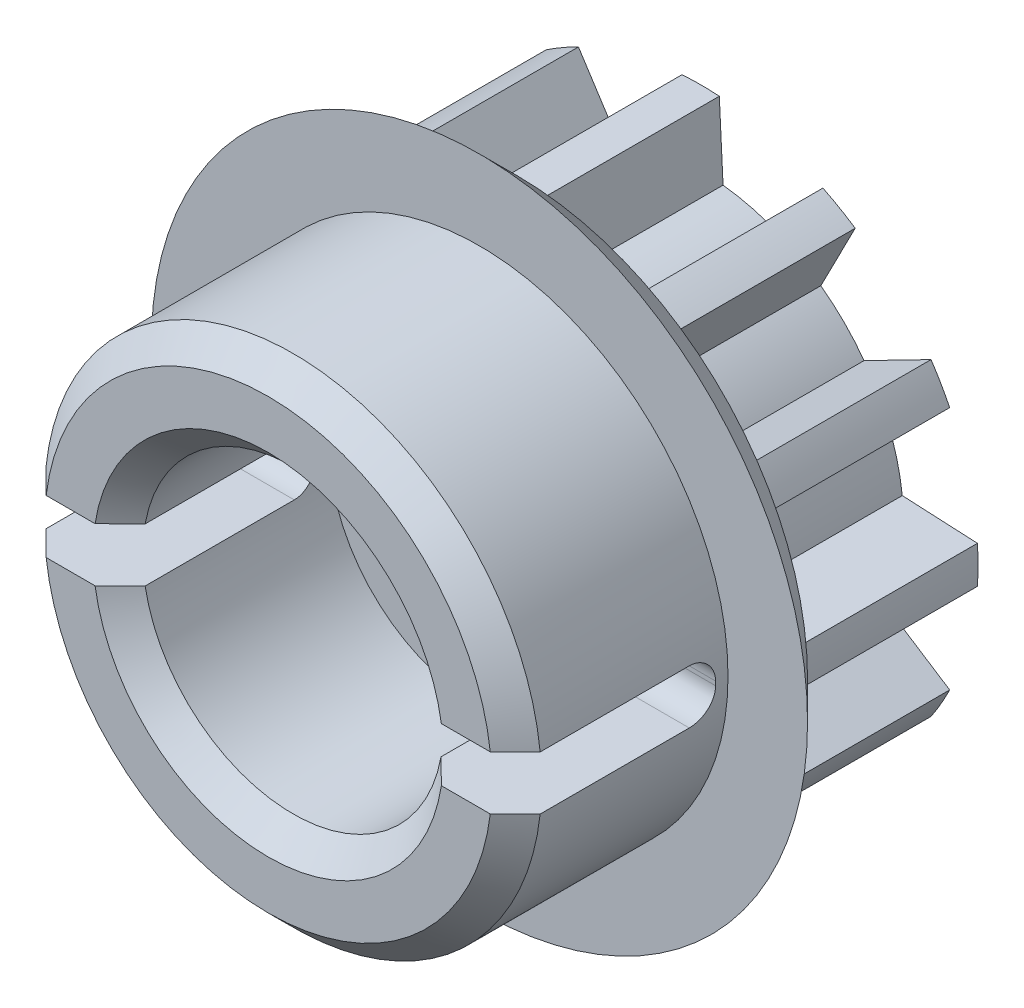
from build123d import *

# Parameters (mm, degrees)
CROQUIS1_R              = 1.85
SALIENTE_EXTRUIR1_DEPTH = 3.7
CROQUIS2_R              = 5
CROQUIS2_R_2            = 3.025
SALIENTE_EXTRUIR2_DEPTH = 5
CHAFL_N1_SIZE           = 0.5
CORTAR_EXTRUIR1_DEPTH   = 2.5
CHAFL_N2_SIZE           = 0.5
CROQUIS4_R              = 4.892614062
CROQUIS4_R_2            = 1.85
SALIENTE_EXTRUIR4_DEPTH = 0.1
CHAFL_N3_SIZE           = 0.5
CROQUIS6_R              = 6.75
CROQUIS6_R_2            = 1.85
SALIENTE_EXTRUIR5_DEPTH = 0.75
CHAFL_N5_SIZE           = 0.9
CHAFL_N7_SIZE           = 1
CROQUIS9_W              = 11.69234849
CROQUIS9_H              = 1.081638158
CORTAR_EXTRUIR2_DEPTH   = 4
REDONDEO1_R             = 0.5
CHAMFER1_SIZE           = 0.5


with BuildPart() as part:
    # Croquis1 → Saliente-Extruir1 (new body)
    with BuildSketch(Plane.XY):
        with BuildLine():
            Line((0.375, 5.567875544), (0.45, 4.055600396))
            ThreePointArc((0.45, 4.055600396), (1.056108396, 3.941450193), (1.638088766, 3.737252971))
            Line((1.638088766, 3.737252971), (2.459178246, 5.009421667))
            ThreePointArc((2.459178246, 5.009421667), (2.790244751, 4.832845674), (3.108697299, 4.634421667))
            Line((3.108697299, 4.634421667), (2.41751163, 3.287252971))
            ThreePointArc((2.41751163, 3.287252971), (2.885341797, 2.885341797), (3.287252971, 2.41751163))
            Line((3.287252971, 2.41751163), (4.634421667, 3.108697299))
            ThreePointArc((4.634421667, 3.108697299), (4.832845674, 2.790244751), (5.009421667, 2.459178246))
            Line((5.009421667, 2.459178246), (3.737252971, 1.638088766))
            ThreePointArc((3.737252971, 1.638088766), (3.941450193, 1.056108396), (4.055600396, 0.45))
            Line((4.055600396, 0.45), (5.567875544, 0.375))
            ThreePointArc((5.567875544, 0.375), (5.580489502, 0), (5.567875544, -0.375))
            Line((5.567875544, -0.375), (4.055600396, -0.45))
            ThreePointArc((4.055600396, -0.45), (3.941450193, -1.056108396), (3.737252971, -1.638088766))
            Line((3.737252971, -1.638088766), (5.009421667, -2.459178246))
            ThreePointArc((5.009421667, -2.459178246), (4.832845674, -2.790244751), (4.634421667, -3.108697299))
            Line((4.634421667, -3.108697299), (3.287252971, -2.41751163))
            ThreePointArc((3.287252971, -2.41751163), (2.885341797, -2.885341797), (2.41751163, -3.287252971))
            Line((2.41751163, -3.287252971), (3.108697299, -4.634421667))
            ThreePointArc((3.108697299, -4.634421667), (2.790244751, -4.832845674), (2.459178246, -5.009421667))
            Line((2.459178246, -5.009421667), (1.638088766, -3.737252971))
            ThreePointArc((1.638088766, -3.737252971), (1.056108396, -3.941450193), (0.45, -4.055600396))
            Line((0.45, -4.055600396), (0.375, -5.567875544))
            ThreePointArc((0.375, -5.567875544), (0, -5.580489502), (-0.375, -5.567875544))
            Line((-0.375, -5.567875544), (-0.45, -4.055600396))
            ThreePointArc((-0.45, -4.055600396), (-1.056108396, -3.941450193), (-1.638088766, -3.737252971))
            Line((-1.638088766, -3.737252971), (-2.459178246, -5.009421667))
            ThreePointArc((-2.459178246, -5.009421667), (-2.790244751, -4.832845674), (-3.108697299, -4.634421667))
            Line((-3.108697299, -4.634421667), (-2.41751163, -3.287252971))
            ThreePointArc((-2.41751163, -3.287252971), (-2.885341797, -2.885341797), (-3.287252971, -2.41751163))
            Line((-3.287252971, -2.41751163), (-4.634421667, -3.108697299))
            ThreePointArc((-4.634421667, -3.108697299), (-4.832845674, -2.790244751), (-5.009421667, -2.459178246))
            Line((-5.009421667, -2.459178246), (-3.737252971, -1.638088766))
            ThreePointArc((-3.737252971, -1.638088766), (-3.941450193, -1.056108396), (-4.055600396, -0.45))
            Line((-4.055600396, -0.45), (-5.567875544, -0.375))
            ThreePointArc((-5.567875544, -0.375), (-5.580489502, 0), (-5.567875544, 0.375))
            Line((-5.567875544, 0.375), (-4.055600396, 0.45))
            ThreePointArc((-4.055600396, 0.45), (-3.941450193, 1.056108396), (-3.737252971, 1.638088766))
            Line((-3.737252971, 1.638088766), (-5.009421667, 2.459178246))
            ThreePointArc((-5.009421667, 2.459178246), (-4.832845674, 2.790244751), (-4.634421667, 3.108697299))
            Line((-4.634421667, 3.108697299), (-3.287252971, 2.41751163))
            ThreePointArc((-3.287252971, 2.41751163), (-2.885341797, 2.885341797), (-2.41751163, 3.287252971))
            Line((-2.41751163, 3.287252971), (-3.108697299, 4.634421667))
            ThreePointArc((-3.108697299, 4.634421667), (-2.790244751, 4.832845674), (-2.459178246, 5.009421667))
            Line((-2.459178246, 5.009421667), (-1.638088766, 3.737252971))
            ThreePointArc((-1.638088766, 3.737252971), (-1.056108396, 3.941450193), (-0.45, 4.055600396))
            Line((-0.45, 4.055600396), (-0.375, 5.567875544))
            ThreePointArc((-0.375, 5.567875544), (0, 5.580489502), (0.375, 5.567875544))
        make_face()
        Circle(CROQUIS1_R, mode=Mode.SUBTRACT)
    extrude(amount=SALIENTE_EXTRUIR1_DEPTH)

    # Croquis2 → Saliente-Extruir2 (add)
    with BuildSketch(Plane.XY.offset(3.7)):
        with Locations(Location((0, 0, 0), (0, 0, 175.365747898))):
            Circle(CROQUIS2_R)
        Circle(CROQUIS2_R_2, mode=Mode.SUBTRACT)
    extrude(amount=SALIENTE_EXTRUIR2_DEPTH)

    # Chaflán1
    chafl_n1_edges = [part.edges().sort_by_distance(p)[0] for p in [
        (4.983653782, -0.403973981, 8.7),
    ]]
    chamfer(chafl_n1_edges, length=CHAFL_N1_SIZE)

    # Croquis8 → Cortar-Extruir1 (cut)
    with BuildSketch(Plane(origin=(0, 0, 0), x_dir=(-1, 0, 0), z_dir=(0, 0, -1))):
        Polygon((-1.48184348, -2.341824054), (1.287157382, -2.454226125), (2.769000862, -0.112402071), (1.48184348, 2.341824054), (-1.287157382, 2.454226125), (-2.769000862, 0.112402071), align=None)
    extrude(amount=-CORTAR_EXTRUIR1_DEPTH, mode=Mode.SUBTRACT)

    # Chaflán2
    chafl_n2_edges = [part.edges().sort_by_distance(p)[0] for p in [
        (-3.025, 0, 8.7),
    ]]
    chamfer(chafl_n2_edges, length=CHAFL_N2_SIZE)

    # Croquis4 → Saliente-Extruir4 (add)
    with BuildSketch(Plane.XY.offset(3.7)):
        Circle(CROQUIS4_R)
        with Locations(Location((0, 0, 0), (0, 0, 180))):
            Circle(CROQUIS4_R_2, mode=Mode.SUBTRACT)
    extrude(amount=SALIENTE_EXTRUIR4_DEPTH)

    # Chaflán3
    chafl_n3_edges = [part.edges().sort_by_distance(p)[0] for p in [
        (-1.056108396, 3.941450193, 3.7),
        (3.941450193, -1.056108396, 3.7),
        (3.941450193, 1.056108396, 3.7),
        (2.885341797, 2.885341797, 3.7),
        (1.056108396, 3.941450193, 3.7),
        (-2.885341797, 2.885341797, 3.7),
        (-3.941450193, 1.056108396, 3.7),
        (-3.941450193, -1.056108396, 3.7),
        (-2.885341797, -2.885341797, 3.7),
        (-1.056108396, -3.941450193, 3.7),
        (1.056108396, -3.941450193, 3.7),
        (2.885341797, -2.885341797, 3.7),
    ]]
    chamfer(chafl_n3_edges, length=CHAFL_N3_SIZE)

    # Croquis6 → Saliente-Extruir5 (add)
    with BuildSketch(Plane.XY.offset(3.7)):
        Circle(CROQUIS6_R)
        with Locations(Location((0, 0, 0), (0, 0, 180))):
            Circle(CROQUIS6_R_2, mode=Mode.SUBTRACT)
    extrude(amount=SALIENTE_EXTRUIR5_DEPTH)

    # Chaflán5
    # the kernel refuses this chamfer: 0.9 mm, written as the material it takes off along each edge
    with BuildSketch(Plane(origin=(0, 0, 3.7), x_dir=(1, 0, 0), z_dir=(0, -1, 0))) as chafl_n5_piece_1:
        Polygon((6.75 - CHAFL_N5_SIZE, 0), (6.75, CHAFL_N5_SIZE), (6.75, 0), align=None)
    revolve(axis=Axis((0, 0, 3.7), (0, 0, 1)), mode=Mode.SUBTRACT)

    # Chaflán7
    # the kernel refuses this chamfer: 1 mm, written as the material it takes off along each edge
    with BuildSketch(Plane(origin=(0, 0, 2.5), x_dir=(1, 0, 0), z_dir=(0, 1, 0))) as chafl_n7_piece_1_section:
        Polygon((1.85 + CHAFL_N7_SIZE, 0), (1.85, -CHAFL_N7_SIZE), (1.85, 0), align=None)
    chafl_n7_piece_1 = revolve(axis=Axis((0, 0, 2.5), (0, 0, -1)), mode=Mode.PRIVATE)
    chafl_n7_piece_1 = split(chafl_n7_piece_1, bisect_by=Plane(origin=(-2.182315628, -2.49056329, 3.04041806), z_dir=(-0.04055960385471344, 0.9991771207024052, 0)), keep=Keep.TOP, mode=Mode.PRIVATE)
    chafl_n7_piece_1 = split(chafl_n7_piece_1, bisect_by=Plane(origin=(-2.680951527, -0.251550406, 3.04041806), z_dir=(0.8450329674811164, 0.534714207656818, 0)), keep=Keep.TOP, mode=Mode.PRIVATE)
    chafl_n7_piece_1 = split(chafl_n7_piece_1, bisect_by=Plane(origin=(-2.618013711, 0.175485499, 3.04041806), z_dir=(0.8855925713358299, -0.4644629130455877, 0)), keep=Keep.TOP, mode=Mode.PRIVATE)
    chafl_n7_piece_1 = split(chafl_n7_piece_1, bisect_by=Plane(origin=(-2.377001726, 2.305486889, 3.04041806), z_dir=(0.040559603854713626, -0.9991771207024052, 0)), keep=Keep.TOP, mode=Mode.PRIVATE)
    chafl_n7_piece_1 = split(chafl_n7_piece_1, bisect_by=Plane(origin=(1.375206717, 2.315077791, 3.04041806), z_dir=(-0.8450329674811162, -0.534714207656818, 0)), keep=Keep.TOP, mode=Mode.PRIVATE)
    chafl_n7_piece_1 = split(chafl_n7_piece_1, bisect_by=Plane(origin=(1.632830632, -2.053936483, 3.04041806), z_dir=(-0.88559257133583, 0.46446291304558773, 0)), keep=Keep.TOP, mode=Mode.PRIVATE)
    add(chafl_n7_piece_1, mode=Mode.SUBTRACT)

    # Croquis9 → Cortar-Extruir2 (cut)
    with BuildSketch(Plane.XY.offset(8.7)):
        with Locations((-0.143563262, 0)):
            Rectangle(CROQUIS9_W, CROQUIS9_H)
    extrude(amount=-CORTAR_EXTRUIR2_DEPTH, mode=Mode.SUBTRACT)

    # Redondeo1
    # the kernel refuses this fillet: 0.5 mm, written as the material it adds along each edge
    with BuildSketch(Plane(origin=(-6.220665421, -0.540819079, 4.7), x_dir=(0, 1, 0), z_dir=(1, 0, 0))) as redondeo1_piece_1_section:
        with BuildLine():
            CenterArc((REDONDEO1_R, REDONDEO1_R), REDONDEO1_R, 180, 90)
            Line((0, REDONDEO1_R), (0, 0))
            Line((0, 0), (REDONDEO1_R, 0))
        make_face()
    redondeo1_piece_1 = extrude(amount=4.49440271, mode=Mode.PRIVATE)
    redondeo1_piece_1 = redondeo1_piece_1 & Plane(origin=(0, 0, 4.813378606), x_dir=(-0.9967307564693295, 0.08079479629331493, 0), z_dir=(0, 0, -1)) * Cylinder(5, 11, mode=Mode.PRIVATE)
    redondeo1_piece_1 = redondeo1_piece_1 - Plane(origin=(0, 0, 4.813378606), x_dir=(1, 0, 0), z_dir=(0, 0, -1)) * Cylinder(3.025, 11, mode=Mode.PRIVATE)
    add(redondeo1_piece_1)
    with BuildSketch(Plane(origin=(6.220665421, 0.540819079, 4.7), x_dir=(0, 0, 1), z_dir=(-1, 0, 0))) as redondeo1_piece_2_section:
        with BuildLine():
            CenterArc((REDONDEO1_R, -REDONDEO1_R), REDONDEO1_R, 90, 90)
            Line((0, -REDONDEO1_R), (0, 0))
            Line((0, 0), (REDONDEO1_R, 0))
        make_face()
    redondeo1_piece_2 = extrude(amount=4.49440271, mode=Mode.PRIVATE)
    redondeo1_piece_2 = redondeo1_piece_2 & Plane(origin=(0, 0, 4.813378556), x_dir=(-0.9967307564693295, 0.08079479629331493, 0), z_dir=(0, 0, -1)) * Cylinder(5, 11, mode=Mode.PRIVATE)
    redondeo1_piece_2 = redondeo1_piece_2 - Plane(origin=(0, 0, 4.813378556), x_dir=(1, 0, 0), z_dir=(0, 0, -1)) * Cylinder(3.025, 11, mode=Mode.PRIVATE)
    add(redondeo1_piece_2)
    with BuildSketch(Plane(origin=(1.726262711, -0.540819079, 4.7), x_dir=(0, 1, 0), z_dir=(1, 0, 0))) as redondeo1_piece_3_section:
        with BuildLine():
            CenterArc((REDONDEO1_R, REDONDEO1_R), REDONDEO1_R, 180, 90)
            Line((0, REDONDEO1_R), (0, 0))
            Line((0, 0), (REDONDEO1_R, 0))
        make_face()
    redondeo1_piece_3 = extrude(amount=4.49440271, mode=Mode.PRIVATE)
    redondeo1_piece_3 = redondeo1_piece_3 & Plane(origin=(0, 0, 4.813378606), x_dir=(-0.9967307564693295, 0.08079479629331493, 0), z_dir=(0, 0, -1)) * Cylinder(5, 11, mode=Mode.PRIVATE)
    redondeo1_piece_3 = redondeo1_piece_3 - Plane(origin=(0, 0, 4.813378606), x_dir=(1, 0, 0), z_dir=(0, 0, -1)) * Cylinder(3.025, 11, mode=Mode.PRIVATE)
    add(redondeo1_piece_3)
    with BuildSketch(Plane(origin=(-1.726262711, 0.540819079, 4.7), x_dir=(0, -1, 0), z_dir=(-1, 0, 0))) as redondeo1_piece_4_section:
        with BuildLine():
            CenterArc((REDONDEO1_R, REDONDEO1_R), REDONDEO1_R, 180, 90)
            Line((0, REDONDEO1_R), (0, 0))
            Line((0, 0), (REDONDEO1_R, 0))
        make_face()
    redondeo1_piece_4 = extrude(amount=4.49440271, mode=Mode.PRIVATE)
    redondeo1_piece_4 = redondeo1_piece_4 & Plane(origin=(0, 0, 4.813378606), x_dir=(-0.9967307564693295, 0.08079479629331493, 0), z_dir=(0, 0, -1)) * Cylinder(5, 11, mode=Mode.PRIVATE)
    redondeo1_piece_4 = redondeo1_piece_4 - Plane(origin=(0, 0, 4.813378606), x_dir=(1, 0, 0), z_dir=(0, 0, -1)) * Cylinder(3.025, 11, mode=Mode.PRIVATE)
    add(redondeo1_piece_4)

    # Chamfer1
    chamfer1_edges = [part.edges().sort_by_distance(p)[0] for p in [
        (2.125422171, -1.114710991, 0),
        (0.097343049, -2.39802509, 0),
        (-2.028079122, -1.283314098, 0),
        (-2.125422171, 1.114710991, 0),
        (-0.097343049, 2.39802509, 0),
        (2.028079122, 1.283314098, 0),
    ]]
    chamfer(chamfer1_edges, length=CHAMFER1_SIZE)


solid = part.part
